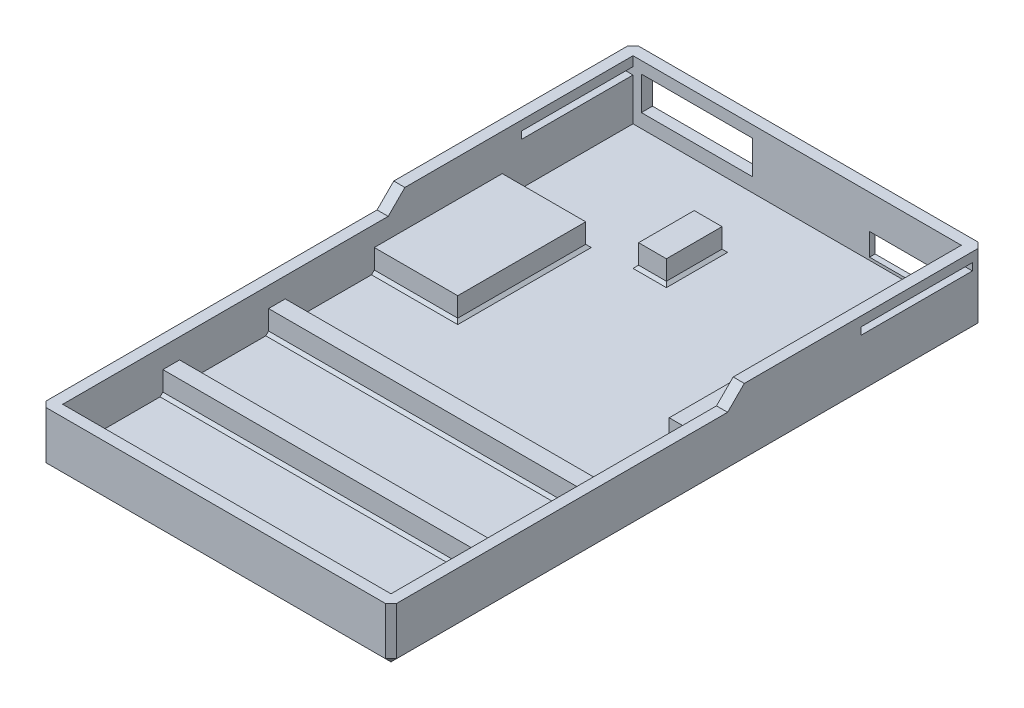
from build123d import *

# Parameters (mm, degrees)
SKETCH1_W               = 59
SKETCH1_H               = 102.5
BOSS_EXTRUDE1_DEPTH     = 2
SKETCH2_W               = 63
SKETCH2_H               = 106.5
SKETCH2_W_2             = 59
SKETCH2_H_2             = 102.5
BOSS_EXTRUDE2_DEPTH     = 12.6
SKETCH4_W               = 59
SKETCH4_H               = 3
SKETCH4_W_2             = 3
SKETCH4_W_3             = 15
SKETCH4_H_2             = 23
SKETCH4_W_4             = 6
SKETCH4_H_3             = 17
SKETCH4_H_4             = 10
SKETCH4_W_5             = 5
BOSS_EXTRUDE3_DEPTH     = 4
CUT_EXTRUDE1_REACH      = 125.378
SKETCH5_W               = 20
SKETCH5_H               = 6
SKETCH5_W_2             = 10.8
SKETCH5_H_2             = 4
CHAMFER1_SIZE           = 0.5
CHAMFER2_SIZE           = 1
SKETCH6_W               = 2
SKETCH6_H               = 1.3
CUT_EXTRUDE2_DEPTH      = 20
CUT_EXTRUDE3_DEPTH      = 122.655291706
CUT_EXTRUDE3_DEPTH_BACK = 122.655291706
SKETCH7_W               = 60.5
SKETCH7_H               = 3
CHAMFER3_SIZE           = 3


with BuildPart() as part:
    # Sketch1 → Boss-Extrude1 (new body)
    with BuildSketch(Plane(origin=(0, 0, 0), x_dir=(1, 0, 0), z_dir=(0, 1, 0))):
        with Locations((29.5, -51.25)):
            Rectangle(SKETCH1_W, SKETCH1_H)
    extrude(amount=BOSS_EXTRUDE1_DEPTH)

    # Sketch2 → Boss-Extrude2 (add)
    with BuildSketch(Plane(origin=(0, 0, 0), x_dir=(1, 0, 0), z_dir=(0, 1, 0))):
        with Locations((29.5, -51.25)):
            Rectangle(SKETCH2_W, SKETCH2_H)
        with Locations((29.5, -51.25)):
            Rectangle(SKETCH2_W_2, SKETCH2_H_2, mode=Mode.SUBTRACT)
    extrude(amount=BOSS_EXTRUDE2_DEPTH)

    # Sketch4 → Boss-Extrude3 (add)
    with BuildSketch(Plane(origin=(0, 2, 0), x_dir=(1, 0, 0), z_dir=(0, 1, 0))):
        with Locations((29.5, -83)):
            Rectangle(SKETCH4_W, SKETCH4_H)
        with Locations((29.5, -64)):
            Rectangle(SKETCH4_W, SKETCH4_H)
        with Locations((16.5, -101)):
            Rectangle(SKETCH4_W_2, SKETCH4_H)
        with Locations((35.5, -101)):
            Rectangle(SKETCH4_W_2, SKETCH4_H)
        with Locations((54.5, -101)):
            Rectangle(SKETCH4_W_2, SKETCH4_H)
        with Locations((7.5, -35)):
            Rectangle(SKETCH4_W_3, SKETCH4_H_2)
        with Locations((56, -38)):
            Rectangle(SKETCH4_W_4, SKETCH4_H_3)
        with Locations((57.5, -5)):
            Rectangle(SKETCH4_W_2, SKETCH4_H_4)
        with Locations((25.5, -17)):
            Rectangle(SKETCH4_W_5, SKETCH4_H_4)
    extrude(amount=BOSS_EXTRUDE3_DEPTH)

    # Sketch5 → Cut-Extrude1 (cut, up to next)
    with BuildSketch(Plane(origin=(0, 0, -2), x_dir=(-1, 0, 0), z_dir=(0, 0, -1)), mode=Mode.PRIVATE) as cut_extrude1_sk1:
        with Locations((-11.5, 7.5)):
            Rectangle(SKETCH5_W, SKETCH5_H)
    cut_extrude1_tool1 = extrude(cut_extrude1_sk1.sketch, amount=-CUT_EXTRUDE1_REACH, mode=Mode.PRIVATE) & part.part
    # Sketch5 → Cut-Extrude1 (cut, up to next)
    with BuildSketch(Plane(origin=(0, 0, -2), x_dir=(-1, 0, 0), z_dir=(0, 0, -1)), mode=Mode.PRIVATE) as cut_extrude1_sk2:
        with Locations((-47.9, 4.5)):
            Rectangle(SKETCH5_W_2, SKETCH5_H_2)
    cut_extrude1_tool2 = extrude(cut_extrude1_sk2.sketch, amount=-CUT_EXTRUDE1_REACH, mode=Mode.PRIVATE) & part.part
    add(cut_extrude1_tool1.solids().sort_by_distance((11.5, 7.5, -2))[0], mode=Mode.SUBTRACT)
    add(cut_extrude1_tool2.solids().sort_by_distance((47.9, 4.5, -2))[0], mode=Mode.SUBTRACT)

    # Chamfer1
    chamfer1_edges = [part.edges().sort_by_distance(p)[0] for p in [
        (18, 2, 101),
        (15, 2, 101),
        (16.5, 2, 99.5),
        (37, 2, 101),
        (34, 2, 101),
        (35.5, 2, 99.5),
        (56, 2, 101),
        (53, 2, 101),
        (54.5, 2, 99.5),
        (29.5, 2, 84.5),
        (29.5, 2, 81.5),
        (28, 2, 17),
        (25.5, 2, 22),
        (23, 2, 17),
        (25.5, 2, 12),
        (56, 2, 5),
        (57.5, 2, 10),
        (56, 2, 46.5),
        (53, 2, 38),
        (56, 2, 29.5),
        (7.5, 2, 23.5),
        (15, 2, 35),
        (7.5, 2, 46.5),
        (29.5, 2, 65.5),
        (29.5, 2, 62.5),
    ]]
    chamfer(chamfer1_edges, length=CHAMFER1_SIZE)

    # Chamfer2
    chamfer2_edges = [part.edges().sort_by_distance(p)[0] for p in [
        (-2, 0, 51.25),
        (-2, 6.3, 104.5),
        (29.5, 0, -2),
        (-2, 6.3, -2),
        (61, 0, 51.25),
        (61, 6.3, -2),
        (29.5, 0, 104.5),
        (61, 6.3, 104.5),
        (53.3, 4.5, -2),
        (47.9, 2.5, -2),
        (42.5, 4.5, -2),
        (47.9, 6.5, -2),
    ]]
    chamfer(chamfer2_edges, length=CHAMFER2_SIZE)

    # Sketch6 → Cut-Extrude2 (cut)
    with BuildSketch(Plane.XY):
        with Locations((-1, 10.25)):
            Rectangle(SKETCH6_W, SKETCH6_H)
        with Locations((60, 10.25)):
            Rectangle(SKETCH6_W, SKETCH6_H)
    extrude(amount=CUT_EXTRUDE2_DEPTH, mode=Mode.SUBTRACT)

    # Sketch7 → Cut-Extrude3 (cut, two sides: drawn at the far end of the back side and taken through both)
    with BuildSketch(Plane(origin=(0, 0, 0), x_dir=(0, 0, -1), z_dir=(1, 0, 0)).offset(-CUT_EXTRUDE3_DEPTH_BACK)):
        with Locations((-74.25, 11.1)):
            Rectangle(SKETCH7_W, SKETCH7_H)
    extrude(amount=CUT_EXTRUDE3_DEPTH + CUT_EXTRUDE3_DEPTH_BACK, mode=Mode.SUBTRACT)

    # Chamfer3
    chamfer3_edges = [part.edges().sort_by_distance(p)[0] for p in [
        (-1, 12.6, 44),
        (60, 12.6, 44),
    ]]
    chamfer(chamfer3_edges, length=CHAMFER3_SIZE - 0.0001)  # a hair under: the kernel refuses the full size


solid = part.part
